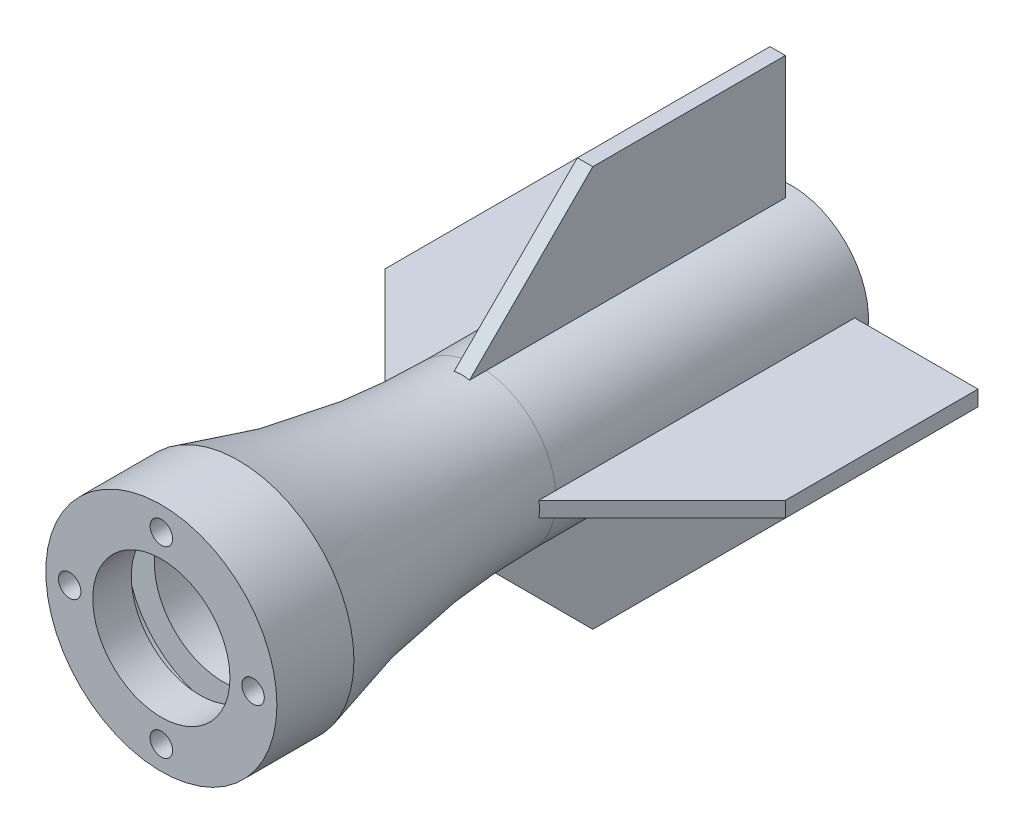
from build123d import *

# Parameters (mm, degrees)
SKETCH1_R              = 12.7
SKETCH1_R_2            = 11.30808
BOSS_EXTRUDE1_DEPTH    = 101.6
BOSS_EXTRUDE4_DEPTH    = 1.27
CIRPATTERN6_COUNT      = 4
BOSS_EXTRUDE5_START    = 1
SKETCH3_R              = 12.7
SKETCH3_R_2            = 1
BOSS_EXTRUDE5_DEPTH    = 1
O_RING_START           = 1.27
SKETCH4_R              = 12.7
SKETCH4_R_2            = 2
O_RING_BODY_HOLD_DEPTH = 1.27
BOSS_EXTRUDE8_START    = -12.7
SKETCH37_R             = 19.05
SKETCH37_R_2           = 11.30808
BOSS_EXTRUDE8_DEPTH    = 12.7
SKETCH38_R             = 1.8542
CUT_EXTRUDE1_DEPTH     = 5.588
SKETCH39_R             = 15.875
SKETCH39_R_2           = 10.16
CUT_EXTRUDE2_DEPTH     = 3.81


with BuildPart() as part:
    # Sketch1 → Boss-Extrude1 (new body)
    with BuildSketch(Plane.XY):
        Circle(SKETCH1_R)
        Circle(SKETCH1_R_2, mode=Mode.SUBTRACT)
    extrude(amount=BOSS_EXTRUDE1_DEPTH)

    # Sketch3 → Boss-Extrude5 (add)
    with BuildSketch(Plane(origin=(0, 0, 0), x_dir=(-1, 0, 0), z_dir=(0, 0, -1)).offset(BOSS_EXTRUDE5_START)):
        Circle(SKETCH3_R)
        Circle(SKETCH3_R_2, mode=Mode.SUBTRACT)
    extrude(amount=-BOSS_EXTRUDE5_DEPTH)

    # Sketch4 → O-Ring Body Hold (add)
    with BuildSketch(Plane(origin=(0, 0, -1), x_dir=(-1, 0, 0), z_dir=(0, 0, -1)).offset(O_RING_START)):
        Circle(SKETCH4_R)
        Circle(SKETCH4_R_2, mode=Mode.SUBTRACT)
    extrude(amount=-O_RING_BODY_HOLD_DEPTH)

    # Sketch37 → Boss-Extrude8 (add)
    with BuildSketch(Plane.XY.offset(101.6).offset(BOSS_EXTRUDE8_START)):
        Circle(SKETCH37_R)
        Circle(SKETCH37_R_2, mode=Mode.SUBTRACT)
    extrude(amount=BOSS_EXTRUDE8_DEPTH)

    # Sketch38 → Cut-Extrude1 (cut)
    with BuildSketch(Plane.XY.offset(101.6)):
        with Locations((-15.11808, 0)):
            Circle(SKETCH38_R)
        with Locations((0, 15.11808)):
            Circle(SKETCH38_R)
        with Locations((15.11808, 0)):
            Circle(SKETCH38_R)
        with Locations((0, -15.11808)):
            Circle(SKETCH38_R)
    extrude(amount=-CUT_EXTRUDE1_DEPTH, mode=Mode.SUBTRACT)

    # Fillet2: read off the stored shape, not the designer's step
    # Fillet2 outline → Fillet2 (revolve)
    with BuildSketch(Plane.XZ):
        with BuildLine():
            ThreePointArc((12.7, 49.24426271), (14.297547871, 69.324725852), (19.05, 88.9))
            Line((19.05, 88.9), (12.7, 88.9))
            Line((12.7, 88.9), (12.7, 49.24426271))
        make_face()
    revolve(axis=Axis((0, 0, 0), (0, 0, 1)))

    # Sketch39 → Cut-Extrude2 (cut)
    with BuildSketch(Plane.XY.offset(95.25)):
        Circle(SKETCH39_R)
        Circle(SKETCH39_R_2, mode=Mode.SUBTRACT)
    extrude(amount=-CUT_EXTRUDE2_DEPTH, mode=Mode.SUBTRACT)


with BuildPart() as body_2:
    # Sketch2 → Boss-Extrude4 (new, symmetric)
    with BuildSketch(Plane(origin=(0, 0, 0), x_dir=(1, 0, 0), z_dir=(0, 1, 0))):
        Polygon((-12.7, -52.07), (-33.02, -31.75), (-33.02, 0), (-12.7, 0), align=None)
    extrude(amount=BOSS_EXTRUDE4_DEPTH, both=True)


with BuildPart() as cirpattern6_1:
    # CirPattern6: pattern copy
    add(body_2.part.rotate(Axis((0, 0, 0), (0, 0, 1)), 1 * 360 / CIRPATTERN6_COUNT))


with BuildPart() as cirpattern6_2:
    # CirPattern6: pattern copy
    add(body_2.part.rotate(Axis((0, 0, 0), (0, 0, 1)), 2 * 360 / CIRPATTERN6_COUNT))


with BuildPart() as cirpattern6_3:
    # CirPattern6: pattern copy
    add(body_2.part.rotate(Axis((0, 0, 0), (0, 0, 1)), 3 * 360 / CIRPATTERN6_COUNT))


solid = Compound([part.part, body_2.part, cirpattern6_1.part, cirpattern6_2.part, cirpattern6_3.part])
